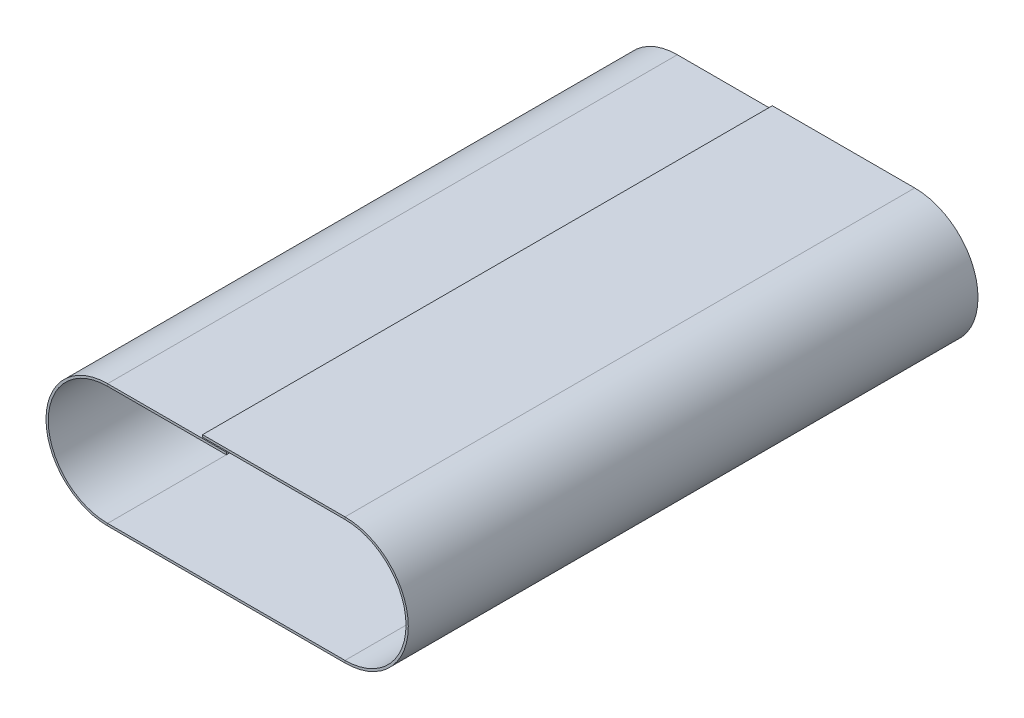
from build123d import *

# Parameters (mm, degrees)
BASE_FLANGE1_DEPTH = 304.8


# Sheet-metal steps are written as plain solids
with BuildPart() as part:
    # Sketch2 → Base-Flange1 (new body)
    with BuildSketch(Plane.XY):
        with BuildLine():
            Line((63.5, 63.5), (0, 63.5))
            ThreePointArc((0, 63.5), (-31.75, 31.75), (0, 0))
            Line((0, 0), (127, 0))
            ThreePointArc((127, 0), (159.639, 32.639), (127, 65.278))
            Line((127, 65.278), (50.8, 65.278))
            Line((50.8, 65.278), (50.8, 66.4972))
            Line((50.8, 66.4972), (127, 66.4972))
            ThreePointArc((127, 66.4972), (160.8582, 32.639), (127, -1.2192))
            Line((127, -1.2192), (0, -1.2192))
            ThreePointArc((0, -1.2192), (-32.9692, 31.75), (0, 64.7192))
            Line((0, 64.7192), (63.5, 64.7192))
            Line((63.5, 64.7192), (63.5, 63.5))
        make_face()
    extrude(amount=BASE_FLANGE1_DEPTH)


solid = part.part
